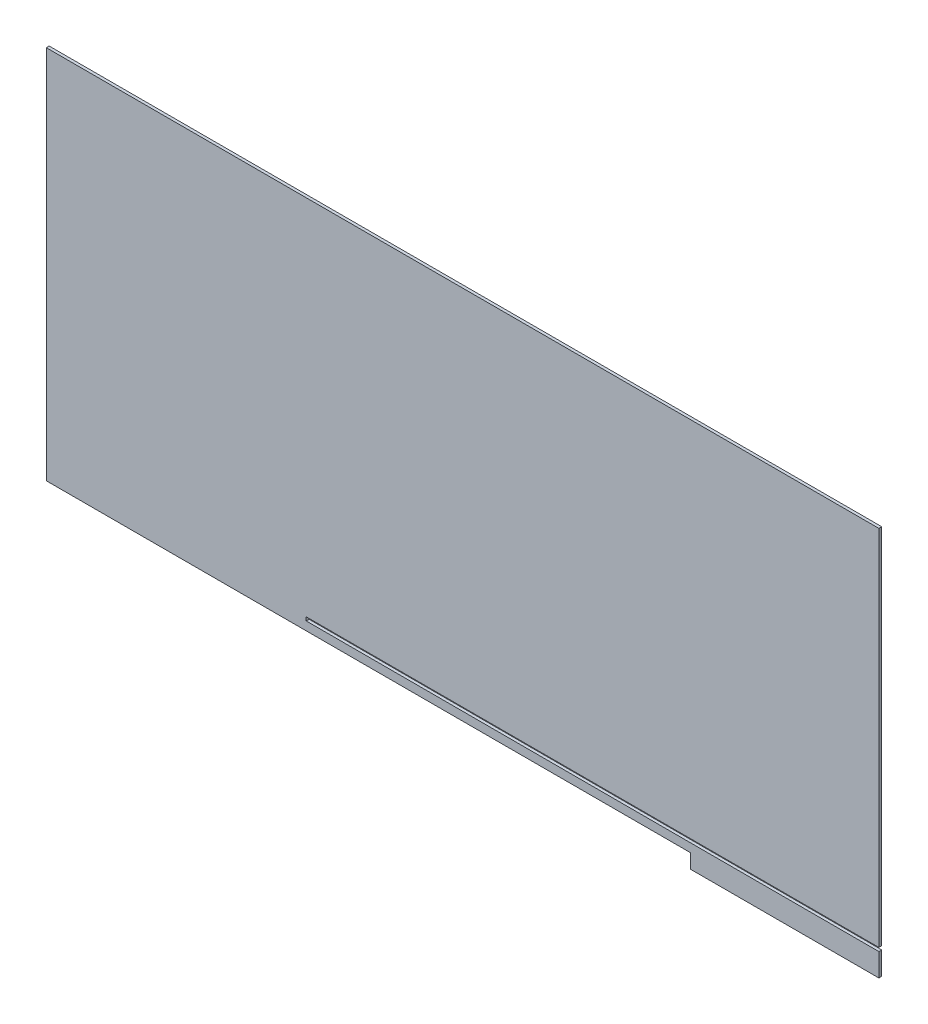
from build123d import *

# Parameters (mm, degrees)
SKETCH1_W           = 581.59
SKETCH1_H           = 272
BOSS_EXTRUDE1_DEPTH = 2
SKETCH2_W           = 400
SKETCH2_H           = 2.5
CUT_EXTRUDE1_DEPTH  = 10
CAVITY2_OUTLINE_W   = 10
CAVITY2_OUTLINE_H   = 2
CAVITY2_DEPTH       = 449.999196591


# Read off the part's stored shape, not the designer's step: Cavity2
with BuildPart() as part:
    # Sketch1 → Boss-Extrude1 (new body)
    with BuildSketch(Plane.XY):
        with Locations((290.795, 136)):
            Rectangle(SKETCH1_W, SKETCH1_H)
    extrude(amount=BOSS_EXTRUDE1_DEPTH)

    # Sketch2 → Cut-Extrude1 (cut)
    with BuildSketch(Plane(origin=(0, 0, 0), x_dir=(-1, 0, 0), z_dir=(0, 0, -1))):
        with Locations((-381.59, 17.25)):
            Rectangle(SKETCH2_W, SKETCH2_H)
    extrude(amount=-CUT_EXTRUDE1_DEPTH, mode=Mode.SUBTRACT)

    # Cavity2 outline → Cavity2 (cut)
    with BuildSketch(Plane.YZ):
        with Locations((5, 1)):
            Rectangle(CAVITY2_OUTLINE_W, CAVITY2_OUTLINE_H)
    extrude(amount=CAVITY2_DEPTH, mode=Mode.SUBTRACT)


solid = part.part
